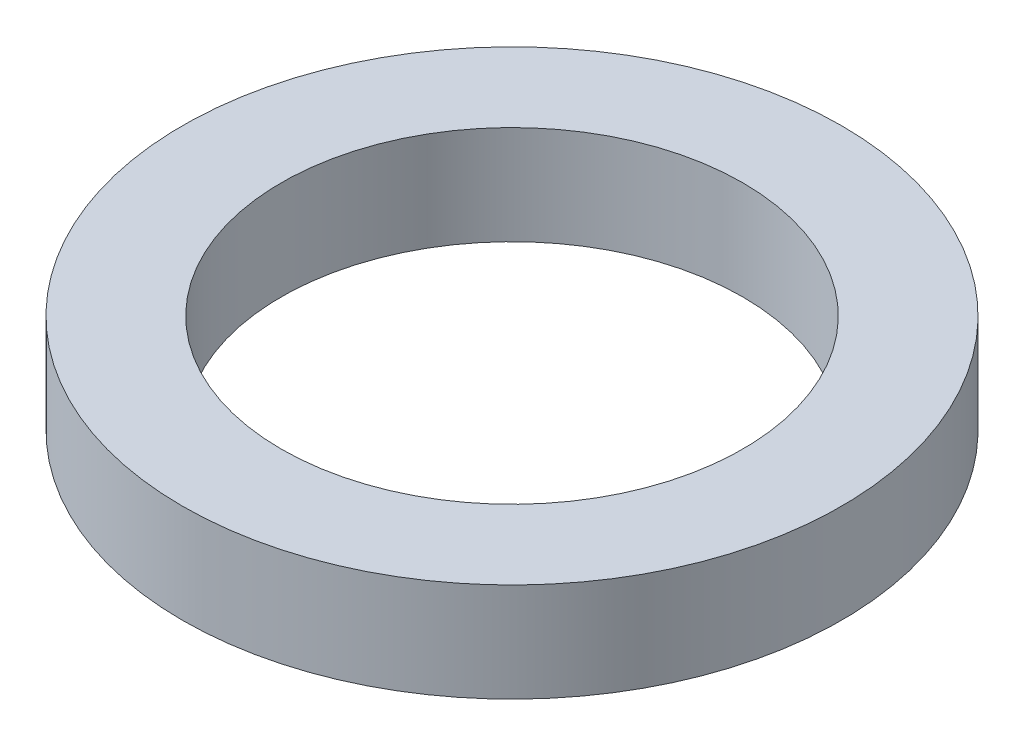
from build123d import *

# Parameters (mm, degrees)
SKETCH1_R           = 5
SKETCH1_R_2         = 3.5005
BOSS_EXTRUDE1_DEPTH = 1.5


with BuildPart() as part:
    # Sketch1 → Boss-Extrude1 (new body)
    with BuildSketch(Plane(origin=(0, 0, 0), x_dir=(1, 0, 0), z_dir=(0, 1, 0))):
        Circle(SKETCH1_R)
        Circle(SKETCH1_R_2, mode=Mode.SUBTRACT)
    extrude(amount=BOSS_EXTRUDE1_DEPTH)


solid = part.part
